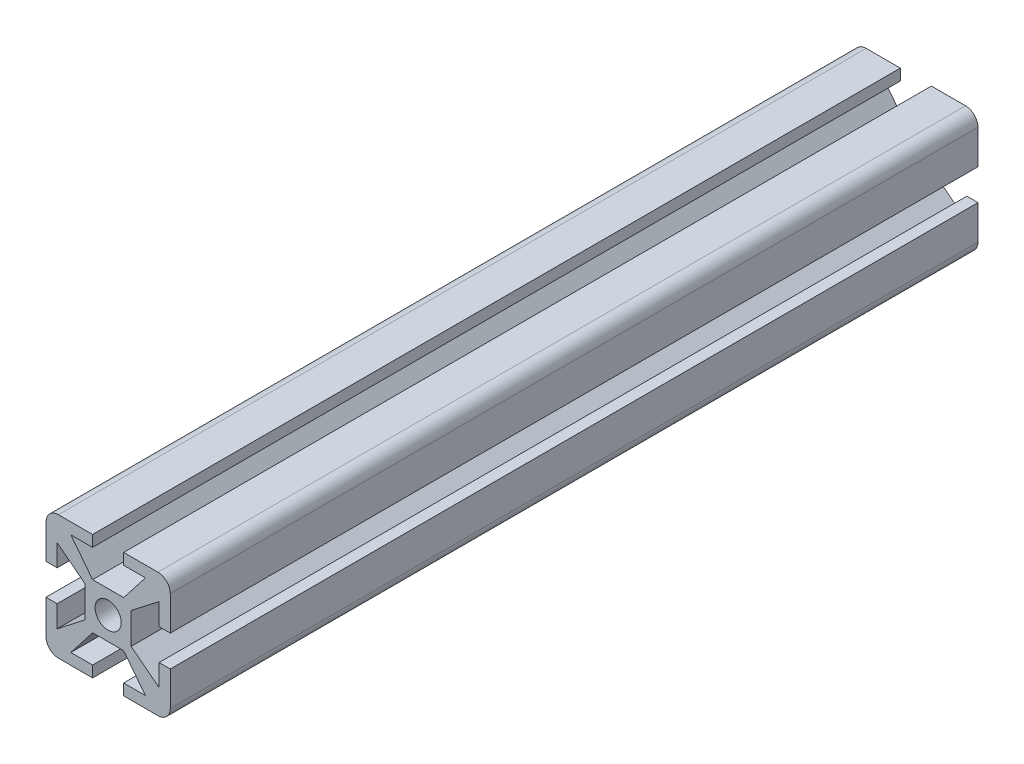
from build123d import *

# Parameters (mm, degrees)
EXTRUSION1_DEPTH        = 130
PER_AGE1_OUTLINE_R      = 2.1
PER_AGE1_DEPTH          = 130
ENL_V_MAT_EXTRU_1_DEPTH = 300
ENL_V_MAT_EXTRU_3_DEPTH = 300
ENL_V_MAT_EXTRU_4_DEPTH = 131.766968306
ENL_V_MAT_EXTRU_7_DEPTH = 131.766968306


# Read off the part's stored shape, not the designer's step: Perçage1
with BuildPart() as part:
    # Esquisse1 → Extrusion1 (new body)
    with BuildSketch(Plane.XY):
        with BuildLine():
            Line((-10, 8), (-10, -8))
            ThreePointArc((-10, -8), (-9.414213562, -9.414213562), (-8, -10))
            Line((-8, -10), (8, -10))
            ThreePointArc((8, -10), (9.414213562, -9.414213562), (10, -8))
            Line((10, -8), (10, 8))
            ThreePointArc((10, 8), (9.414213562, 9.414213562), (8, 10))
            Line((8, 10), (-8, 10))
            ThreePointArc((-8, 10), (-9.414213562, 9.414213562), (-10, 8))
        make_face()
    extrude(amount=EXTRUSION1_DEPTH)

    # Perçage1 outline → Perçage1 (cut)
    with BuildSketch(Plane.XY):
        Circle(PER_AGE1_OUTLINE_R)
    extrude(amount=PER_AGE1_DEPTH, mode=Mode.SUBTRACT)

    # Esquisse3 → Enlèv. mat.-Extru.1 (cut)
    with BuildSketch(Plane.XY.offset(130)):
        Polygon((10, 2.5), (8.2, 2.5), (8.2, 6), (3.7, 2.5), (3.7, -2.5), (8.2, -6), (8.2, -2.5), (10, -2.5), align=None)
    extrude(amount=-ENL_V_MAT_EXTRU_1_DEPTH, mode=Mode.SUBTRACT)

    # Esquisse5 → Enlèv. mat.-Extru.3 (cut)
    with BuildSketch(Plane.XY.offset(130)):
        Polygon((-2.5, 10), (-2.5, 8.2), (-6, 8.2), (-2.5, 3.7), (2.5, 3.7), (6, 8.2), (2.5, 8.2), (2.5, 10), align=None)
    extrude(amount=-ENL_V_MAT_EXTRU_3_DEPTH, mode=Mode.SUBTRACT)

    # Esquisse6 → Enlèv. mat.-Extru.4 (cut, through all)
    with BuildSketch(Plane.XY.offset(130)):
        Polygon((-2.5, -10), (-2.5, -8.2), (-6, -8.2), (-2.5, -3.7), (2.5, -3.7), (6, -8.2), (2.5, -8.2), (2.5, -10), align=None)
    extrude(amount=-ENL_V_MAT_EXTRU_4_DEPTH, mode=Mode.SUBTRACT)

    # Esquisse4 → Enlèv. mat.-Extru.7 (cut, through all)
    with BuildSketch(Plane.XY.offset(130)):
        Polygon((-10, 2.5), (-8.2, 2.5), (-8.2, 6), (-3.7, 2.5), (-3.7, -2.5), (-8.2, -6), (-8.2, -2.5), (-10, -2.5), align=None)
    extrude(amount=-ENL_V_MAT_EXTRU_7_DEPTH, mode=Mode.SUBTRACT)


solid = part.part
